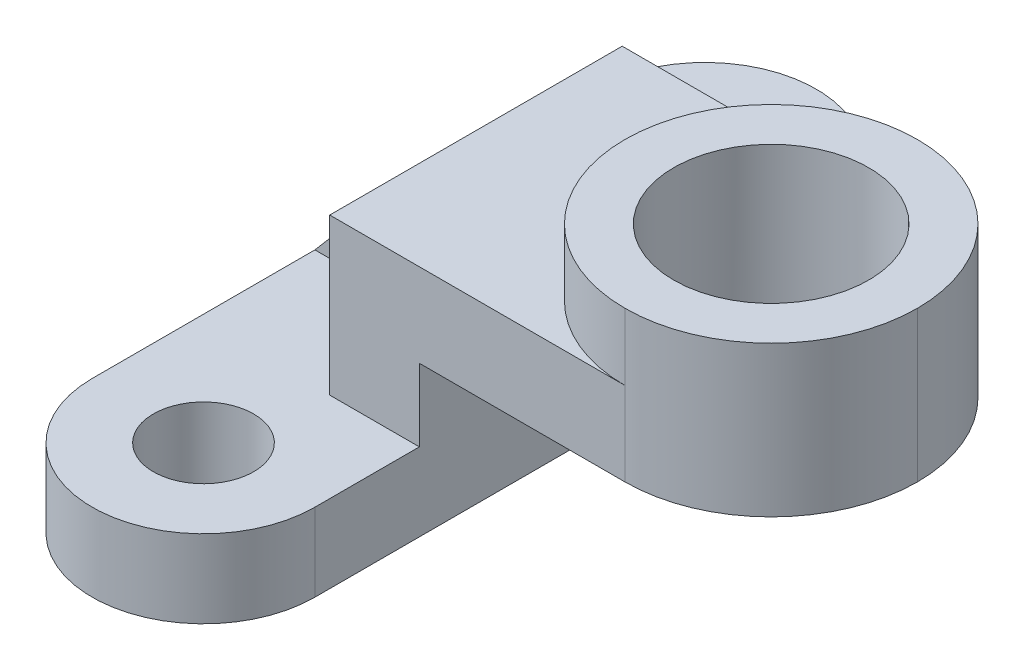
from build123d import *

# Parameters (mm, degrees)
EXTRUDE_1_DEPTH     = 52.5
FILLET_1_R          = 52.5
SKETCH_2_R          = 35
CUT_EXTRUDE_1_DEPTH = 105
SKETCH_3_R          = 18
EXTRUDE_2_DEPTH     = 28
RIB_1_REACH         = 193.948
SKETCH_5_WALL_W     = 459.539721034
SKETCH_5_WALL_H     = 20


with BuildPart() as part:
    # 스케치1 → 보스-돌출1 (new, symmetric)
    with BuildSketch(Plane.XY):
        Polygon((-68.904487954, -51.485249183), (-68.904487954, 4.514750817), (-15.404487954, 4.514750817), (-15.404487954, 28.514750817), (89.595512046, 28.514750817), (89.595512046, -25.485249183), (-36.731091279, -25.485249183), (-36.731091279, -51.485249183), align=None)
    extrude(amount=EXTRUDE_1_DEPTH, both=True)

    # 필렛1
    fillet_1_edges = [part.edges().sort_by_distance(p)[0] for p in [
        (-15.404487954, 16.514750817, -52.5),
        (-15.404487954, 16.514750817, 52.5),
        (89.595512046, 1.514750817, 52.5),
        (89.595512046, 1.514750817, -52.5),
    ]]
    fillet(fillet_1_edges, radius=FILLET_1_R - 0.0001)  # a hair under: the kernel refuses the full size

    # 스케치2 → 컷-돌출1 (cut)
    with BuildSketch(Plane(origin=(0, 28.514750817, 0), x_dir=(1, 0, 0), z_dir=(0, 1, 0))):
        with Locations(Location((37.095512046, 0, 0), (0, 0, 270))):
            Circle(SKETCH_2_R)
    extrude(amount=-CUT_EXTRUDE_1_DEPTH, mode=Mode.SUBTRACT)

    # 스케치3 → 보스-돌출2 (add)
    with BuildSketch(Plane.XZ.offset(51.485249183)):
        with BuildLine():
            Line((-36.731091279, 90), (-36.731091279, -90))
            ThreePointArc((-36.731091279, -90), (-76.731091279, -130), (-116.731091279, -90))
            Line((-116.731091279, -90), (-116.731091279, 90))
            ThreePointArc((-116.731091279, 90), (-76.731091279, 130), (-36.731091279, 90))
        make_face()
        with Locations(Location((-76.731091279, 90, 0), (0, 0, 270))):
            Circle(SKETCH_3_R, mode=Mode.SUBTRACT)
        with Locations(Location((-76.731091279, -90, 0), (0, 0, 270))):
            Circle(SKETCH_3_R, mode=Mode.SUBTRACT)
    extrude(amount=EXTRUDE_2_DEPTH)

    # 스케치5 wall → 보강대1 (add, up to next)
    with BuildSketch(Plane(origin=(-92.817789616, -23.485249183, 0), x_dir=(-0.649433011991, -0.76041880759, 0), z_dir=(0.76041880759, -0.649433011991, 0)), mode=Mode.PRIVATE) as rib_1_sk1:
        Rectangle(SKETCH_5_WALL_W, SKETCH_5_WALL_H)
    rib_1_tool1 = extrude(rib_1_sk1.sketch, amount=RIB_1_REACH, mode=Mode.PRIVATE) - part.part
    add(rib_1_tool1.solids().sort_by_distance((-92.817789616, -23.485249183, 0))[0])


solid = part.part
